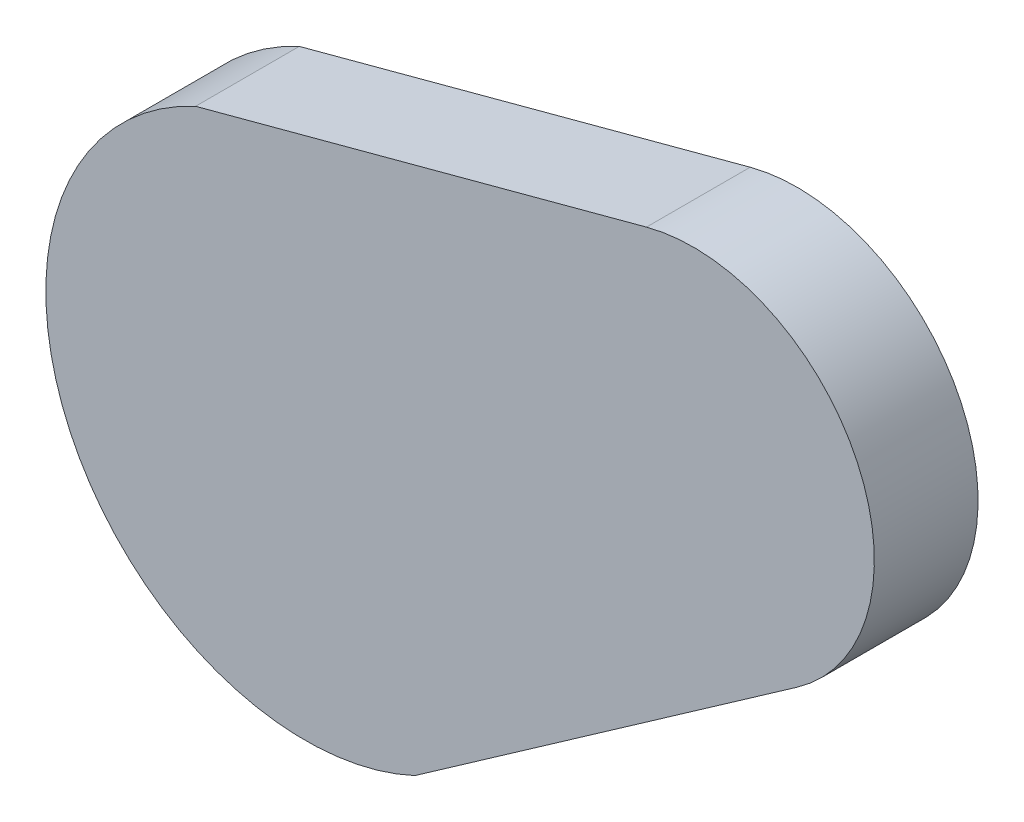
from build123d import *

# Parameters (mm, degrees)
EXTRUDE_3_DEPTH = 10


with BuildPart() as part:
    # 草图3 → 凸台-拉伸3 (new body)
    with BuildSketch(Plane.XY.offset(10)):
        with BuildLine():
            Line((-10.565456544, -57.342305324), (32.901205639, -45.695448294))
            ThreePointArc((32.901205639, -45.695448294), (53.233777088, -55.176682071), (47.427298537, -76.84675504))
            Line((47.427298537, -76.84675504), (10.565456544, -102.657694676))
            ThreePointArc((10.565456544, -102.657694676), (-22.657694676, -90.565456544), (-10.565456544, -57.342305324))
        make_face()
    extrude(amount=EXTRUDE_3_DEPTH)


solid = part.part
